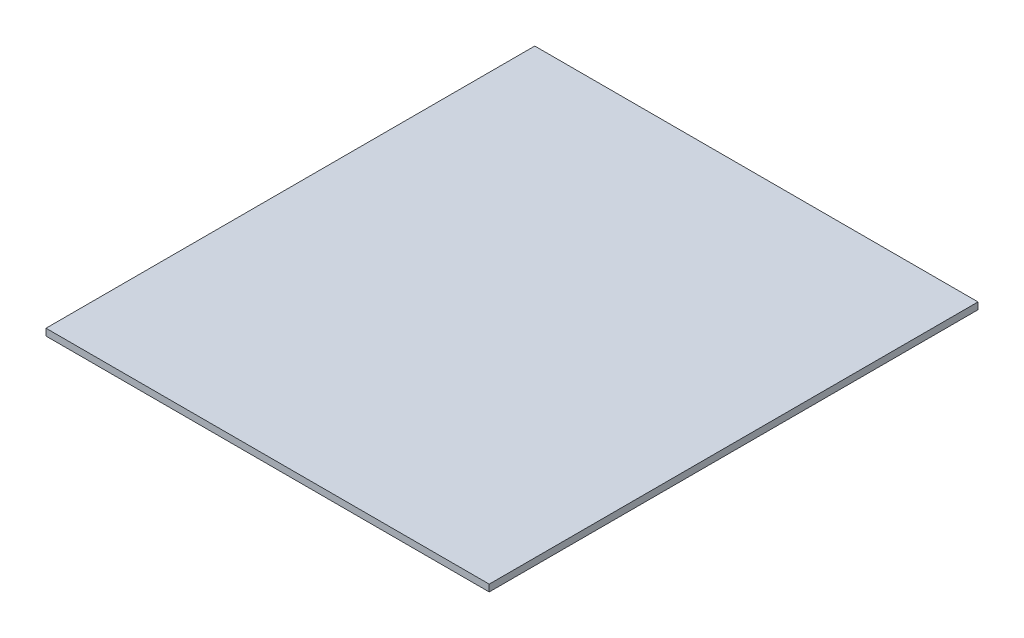
from build123d import *

# Parameters (mm, degrees)
SKETCH1_W           = 206.375
SKETCH1_H           = 227.584
BOSS_EXTRUDE1_DEPTH = 3.175


with BuildPart() as part:
    # Sketch1 → Boss-Extrude1 (new body)
    with BuildSketch(Plane(origin=(0, 0, 0), x_dir=(1, 0, 0), z_dir=(0, 1, 0))):
        Rectangle(SKETCH1_W, SKETCH1_H)
    extrude(amount=BOSS_EXTRUDE1_DEPTH)


solid = part.part
